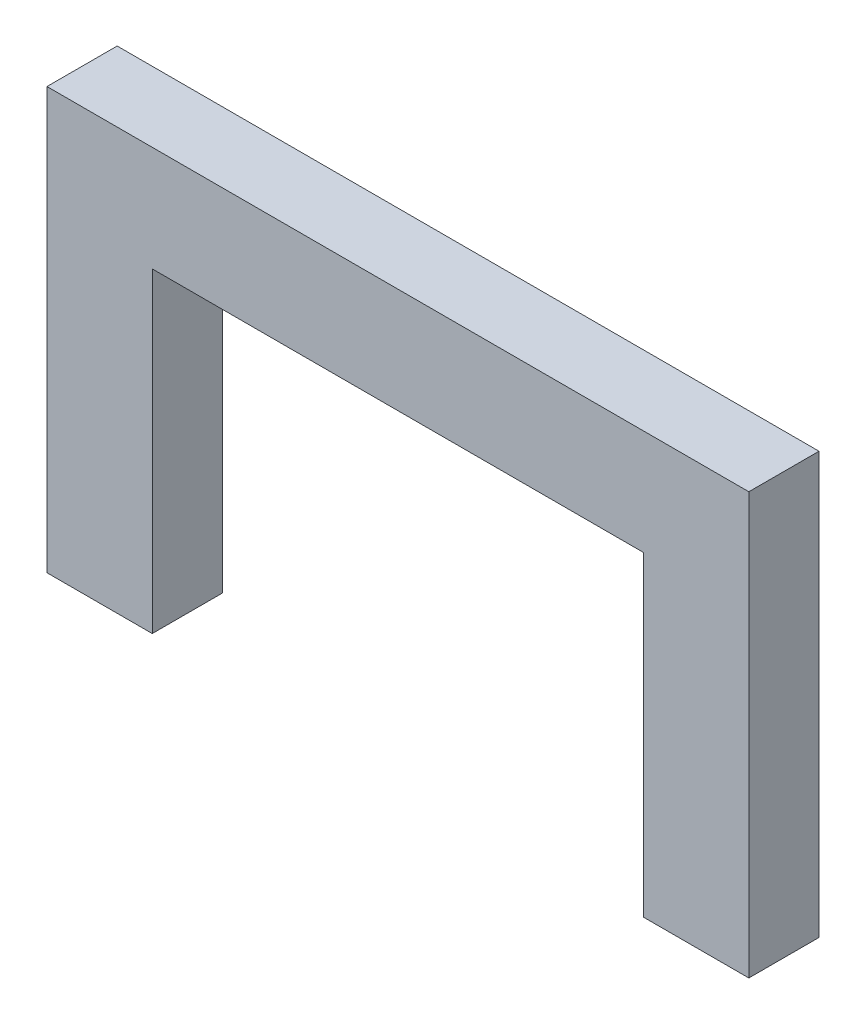
from build123d import *

# Parameters (mm, degrees)
BOSS_EXTRUDE1_DEPTH = 12.7


with BuildPart() as part:
    # Sketch2 → Boss-Extrude1 (new body)
    with BuildSketch(Plane.XY):
        Polygon((80.149116608, 36.215194346), (-46.850883392, 36.215194346), (-46.850883392, -39.984805654), (-27.800883392, -39.984805654), (-27.800883392, 17.165194346), (61.099116608, 17.165194346), (61.099116608, -39.984805654), (80.149116608, -39.984805654), align=None)
    extrude(amount=BOSS_EXTRUDE1_DEPTH)


solid = part.part
